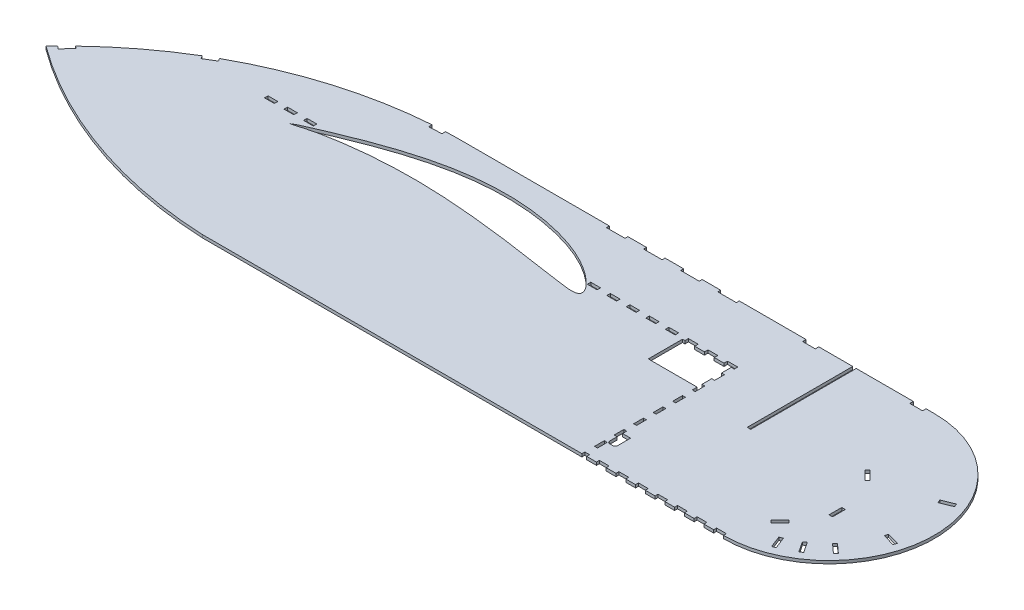
from build123d import *

# Parameters (mm, degrees)
BOSS_EXTRUDE1_DEPTH = 3
SKETCH2_W           = 3.6
SKETCH2_H           = 13
SKETCH2_W_2         = 13
SKETCH2_H_2         = 3.6
SKETCH2_W_3         = 19
SKETCH2_H_3         = 3
SKETCH2_W_4         = 10
SKETCH2_W_5         = 3
SKETCH2_H_4         = 10
SKETCH2_W_6         = 4.93
SKETCH2_H_5         = 108
CUT_EXTRUDE1_DEPTH  = 934.342916617


with BuildPart() as part:
    # Sketch1 → Boss-Extrude1 (new body)
    with BuildSketch(Plane(origin=(0, 0, 0), x_dir=(1, 0, 0), z_dir=(0, 1, 0))):
        with BuildLine():
            Line((266.408252791, 0), (800, 0))
            ThreePointArc((800, 0), (908, 108), (800, 216))
            Line((800, 216), (316.294556964, 216))
            ThreePointArc((316.294556964, 216), (154.432198565, 182.326352039), (19.429068043, 86.893169221))
            ThreePointArc((19.429068043, 86.893169221), (136.475600537, 25.133273094), (266.408252791, 0))
        make_face()
    extrude(amount=BOSS_EXTRUDE1_DEPTH)

    # Sketch2 → Cut-Extrude1 (cut, through all)
    with BuildSketch(Plane.XZ):
        Polygon((647.57, -153), (637.57, -153), (637.57, -156.6), (627.57, -156.6), (627.57, -153), (617.57, -153), (617.57, -156.6), (607.57, -156.6), (607.57, -153), (605.07, -153), (605.07, -118), (655.07, -118), (655.07, -113), (658.07, -113), (658.07, -123), (655.07, -123), (655.07, -133), (658.07, -133), (658.07, -143), (655.07, -143), (655.07, -153), (658.07, -153), (658.07, -156.6), (647.57, -156.6), align=None)
        Polygon((823.689305433, -121.232773417), (814.496917278, -130.425161573), (817.04250169, -132.970745985), (826.234889846, -123.77835783), align=None)
        Polygon((833.216286063, -28.127768374), (837.957262065, -16.023093799), (834.605198337, -14.710208137), (829.864222335, -26.814882712), align=None)
        with Locations((837.65655194, -78.816857664)):
            Rectangle(SKETCH2_W, SKETCH2_H)
        with BuildLine():
            Line((658.07, -25.473381029), (658.07, -33))
            Line((658.07, -33), (655.07, -33))
            Line((655.07, -33), (655.07, -43))
            Line((655.07, -43), (658.07, -43))
            Line((658.07, -43), (658.07, -38.673381029))
            Line((658.07, -38.673381029), (666.27, -38.673381029))
            Line((666.27, -38.673381029), (666.27, -25.473381029))
            ThreePointArc((666.27, -25.473381029), (665.537766953, -23.705614076), (663.77, -22.973381029))
            Line((663.77, -22.973381029), (660.57, -22.973381029))
            ThreePointArc((660.57, -22.973381029), (658.802233047, -23.705614076), (658.07, -25.473381029))
        make_face()
        with BuildLine():
            Line((212.57, -142.861782597), (212.57, -142.894782597))
            add(Edge.make_bspline(
                [(212.57, -142.894782597), (212.815137814, -143.060102486), (213.721483955, -143.671338431), (215.664179604, -144.820627165), (218.723437449, -146.377902142), (222.783765044, -148.180430449), (227.75908382, -150.380753256), (233.673151887, -152.972942719), (243.334631626, -157.073964415), (254.071597155, -161.528560196), (265.811315632, -166.151386352), (275.559769605, -169.792616013), (285.820264156, -173.389650289), (300.213165162, -178.042893994), (315.047470761, -182.21442891), (330.216772764, -185.678244178), (341.716798025, -187.862793988), (353.238408154, -189.570546018), (364.74982071, -190.789827969), (376.222154657, -191.489317525), (387.611451467, -191.686885836), (398.853751386, -191.364655348), (413.421420996, -190.296341642), (427.580802498, -188.300042396), (441.195366572, -185.427458978), (450.821943115, -182.919735681), (459.948918056, -180.069695278), (468.511745548, -176.887644359), (476.453624938, -173.424739179), (483.715148146, -169.728859345), (490.24814377, -165.884833696), (496.019667562, -162.00694583), (500.998027396, -158.185747413), (505.147593549, -154.484087589), (508.447339472, -150.982728864), (510.852240131, -147.780842115), (512.23052565, -145.118995071), (512.672376723, -143.038033672), (512.365957104, -141.293980261), (510.836297954, -139.867947677), (508.300825673, -139.204557497), (504.990749494, -138.996901122), (500.845143819, -139.232879923), (495.886387834, -139.807005807), (490.127383335, -140.633765729), (483.600688534, -141.61415409), (476.345974836, -142.681971784), (468.41886468, -143.870863791), (459.86962452, -145.152957933), (447.40415706, -147.014008038), (434.302787697, -148.89198326), (413.230560269, -151.680307043), (394.916461571, -153.770522792), (372.413070638, -155.785169178), (353.278576878, -157.097400442), (334.10390548, -157.72050793), (318.83753012, -157.719300437), (307.569298967, -157.463067348), (296.54483902, -156.942386113), (285.853643217, -156.19861473), (275.586288909, -155.254588864), (265.829573747, -154.156930461), (256.673464041, -152.912824912), (248.205041684, -151.55854436), (240.510067524, -150.123302558), (233.666056009, -148.664077742), (227.735558734, -147.229571507), (222.771530443, -145.80558608), (218.774640723, -144.512633605), (215.724793866, -143.595242016), (213.753356987, -143.096728121), (212.816237246, -142.910670921), (212.57, -142.861782597)],
                knots=[0, 0, 0, 0, 0.001413477, 0.005226038, 0.010781091, 0.017815608, 0.026460951, 0.036790889, 0.048685593, 0.076639155, 0.092362872, 0.109003461, 0.126386903, 0.144339126, 0.181312719, 0.200023431, 0.218712626, 0.237261299, 0.255692478, 0.274037197, 0.292192583, 0.310132767, 0.327788163, 0.362001934, 0.378421226, 0.394286639, 0.40954344, 0.424114253, 0.43793778, 0.450941833, 0.463044023, 0.474154417, 0.484164575, 0.493023962, 0.500713088, 0.507125739, 0.512129705, 0.514904185, 0.517171427, 0.520261618, 0.5242453, 0.529497961, 0.536092185, 0.54406114, 0.553363127, 0.563904543, 0.575614949, 0.588420092, 0.60222661, 0.616944448, 0.648675826, 0.665501113, 0.718564132, 0.736789145, 0.773513212, 0.810244924, 0.828488569, 0.846493195, 0.864125178, 0.88124851, 0.897725282, 0.913415058, 0.928184346, 0.941897285, 0.954411455, 0.965602702, 0.975349728, 0.983575522, 0.990284579, 0.99543259, 0.998799869, 1, 1, 1, 1], degree=3))
        make_face()
        Polygon((879.46612068, -142.176464254), (891.512779688, -147.062976992), (892.865967831, -143.726979113), (880.819308823, -138.840466375), align=None)
        Polygon((883.56409693, -85.640734603), (896.049682188, -82.019939003), (895.047000329, -78.562392317), (882.561415072, -82.183187916), align=None)
        Polygon((865.40073975, -51.381643569), (875.050147879, -42.670218728), (872.637753308, -39.998074939), (862.988345179, -48.709499779), align=None)
        Polygon((849.114653162, -36.791532178), (856.271451565, -25.938871831), (853.266099469, -23.956989196), (846.109301066, -34.809649543), align=None)
        Polygon((822.408918344, -44.734564455), (813.216530188, -35.542176299), (810.670945776, -38.087760711), (819.863333931, -47.280148867), align=None)
        with Locations((785, -214.2)):
            Rectangle(SKETCH2_W_2, SKETCH2_H_2)
        with Locations((675.107627624, -214.2)):
            Rectangle(SKETCH2_W_2, SKETCH2_H_2)
        with Locations((590.701810534, -214.5)):
            Rectangle(SKETCH2_W_3, SKETCH2_H_3)
        with Locations((552.701810534, -214.5)):
            Rectangle(SKETCH2_W_3, SKETCH2_H_3)
        with Locations((514.701810534, -214.5)):
            Rectangle(SKETCH2_W_3, SKETCH2_H_3)
        with Locations((476.701810534, -214.5)):
            Rectangle(SKETCH2_W_3, SKETCH2_H_3)
        Polygon((286.653605669, -215.067910052), (299.639993398, -215.662665262), (299.804694841, -212.066434814), (286.818307112, -211.471679604), align=None)
        Polygon((107.891846949, -158.40758228), (119.051202256, -165.076074548), (120.897861653, -161.98579154), (109.738506346, -155.317299272), align=None)
        Polygon((25.225136805, -93.110530953), (34.089712558, -102.619437132), (36.722948115, -100.164631538), (27.858372362, -90.65572536), align=None)
        with Locations((532.57, -154.8)):
            Rectangle(SKETCH2_W_4, SKETCH2_H_2)
        with Locations((552.57, -154.8)):
            Rectangle(SKETCH2_W_4, SKETCH2_H_2)
        with Locations((572.57, -154.8)):
            Rectangle(SKETCH2_W_4, SKETCH2_H_2)
        with Locations((592.57, -154.8)):
            Rectangle(SKETCH2_W_4, SKETCH2_H_2)
        with Locations((656.57, -98)):
            Rectangle(SKETCH2_W_5, SKETCH2_H_4)
        with Locations((656.57, -78)):
            Rectangle(SKETCH2_W_5, SKETCH2_H_4)
        with Locations((656.57, -58)):
            Rectangle(SKETCH2_W_5, SKETCH2_H_4)
        with Locations((656.57, -18)):
            Rectangle(SKETCH2_W_5, SKETCH2_H_4)
        with Locations((657.535, -1.5)):
            Rectangle(SKETCH2_W_6, SKETCH2_H_3)
        with Locations((675, -1.5)):
            Rectangle(SKETCH2_W_4, SKETCH2_H_3)
        with Locations((695, -1.5)):
            Rectangle(SKETCH2_W_4, SKETCH2_H_3)
        with Locations((715, -1.5)):
            Rectangle(SKETCH2_W_4, SKETCH2_H_3)
        with Locations((735, -1.5)):
            Rectangle(SKETCH2_W_4, SKETCH2_H_3)
        with Locations((755, -1.5)):
            Rectangle(SKETCH2_W_4, SKETCH2_H_3)
        with Locations((775, -1.5)):
            Rectangle(SKETCH2_W_4, SKETCH2_H_3)
        with Locations((795, -1.5)):
            Rectangle(SKETCH2_W_4, SKETCH2_H_3)
        with Locations((182.07, -154.8)):
            Rectangle(SKETCH2_W_4, SKETCH2_H_2)
        with Locations((202.07, -154.8)):
            Rectangle(SKETCH2_W_4, SKETCH2_H_2)
        with Locations((222.07, -154.8)):
            Rectangle(SKETCH2_W_4, SKETCH2_H_2)
        with Locations((512.57, -154.8)):
            Rectangle(SKETCH2_W_4, SKETCH2_H_2)
        with Locations((718.2, -162)):
            Rectangle(SKETCH2_W, SKETCH2_H_5)
    extrude(amount=-CUT_EXTRUDE1_DEPTH, mode=Mode.SUBTRACT)


solid = part.part
